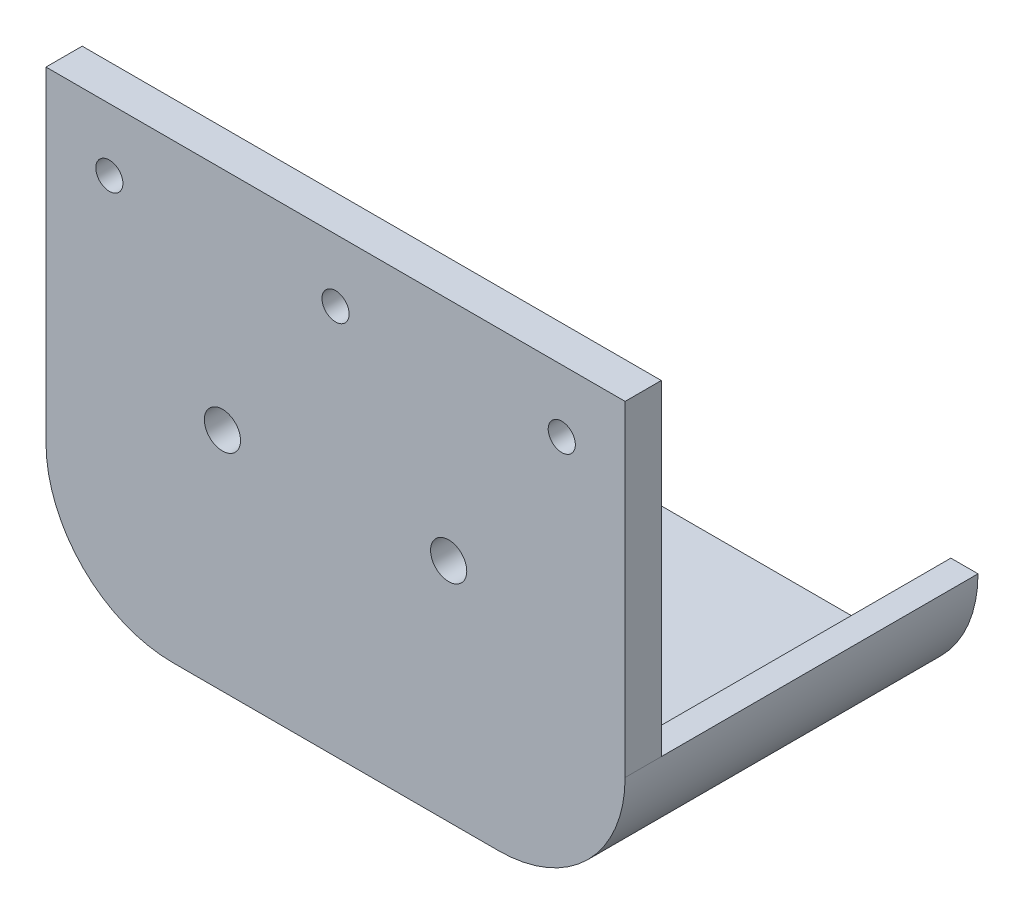
from build123d import *

# Parameters (mm, degrees)
SKETCH1_W           = 320
SKETCH1_H           = 250
SKETCH1_R           = 10
BOSS_EXTRUDE1_DEPTH = 20
SKETCH2_R           = 7.5
CUT_EXTRUDE1_DEPTH  = 205.022057631
FILLET1_R           = 70
BOSS_EXTRUDE2_DEPTH = 175


# Read off the part's stored shape, not the designer's step: Boss-Extrude2
with BuildPart() as part:
    # Sketch1 → Boss-Extrude1 (new body)
    with BuildSketch(Plane.XY):
        Rectangle(SKETCH1_W, SKETCH1_H)
        with Locations((62.5, 0)):
            Circle(SKETCH1_R, mode=Mode.SUBTRACT)
        with Locations((-62.5, 0)):
            Circle(SKETCH1_R, mode=Mode.SUBTRACT)
    extrude(amount=BOSS_EXTRUDE1_DEPTH)

    # Sketch2 → Cut-Extrude1 (cut, through all)
    with BuildSketch(Plane.XY.offset(20)):
        with Locations((0, 90.519334951)):
            Circle(SKETCH2_R)
        with Locations((-125, 90.519334951)):
            Circle(SKETCH2_R)
        with Locations((125, 90.519334951)):
            Circle(SKETCH2_R)
    extrude(amount=-CUT_EXTRUDE1_DEPTH, mode=Mode.SUBTRACT)

    # Fillet1
    fillet1_edges = [part.edges().sort_by_distance(p)[0] for p in [
        (160, -125, 10),
        (-160, -125, 10),
    ]]
    fillet(fillet1_edges, radius=FILLET1_R)

    # Boss-Extrude2 outline → Boss-Extrude2 (add)
    with BuildSketch(Plane(origin=(0, 0, 0), x_dir=(-1, 0, 0), z_dir=(0, 0, -1))):
        with BuildLine():
            Line((-90, -125), (90, -125))
            ThreePointArc((90, -125), (139.497474683, -104.497474683), (160, -55))
            Line((160, -55), (145, -55))
            ThreePointArc((145, -55), (128.890872965, -93.890872965), (90, -110))
            Line((90, -110), (-90, -110))
            ThreePointArc((-90, -110), (-128.890872965, -93.890872965), (-145, -55))
            Line((-145, -55), (-160, -55))
            ThreePointArc((-160, -55), (-139.497474683, -104.497474683), (-90, -125))
        make_face()
    extrude(amount=BOSS_EXTRUDE2_DEPTH)


solid = part.part
